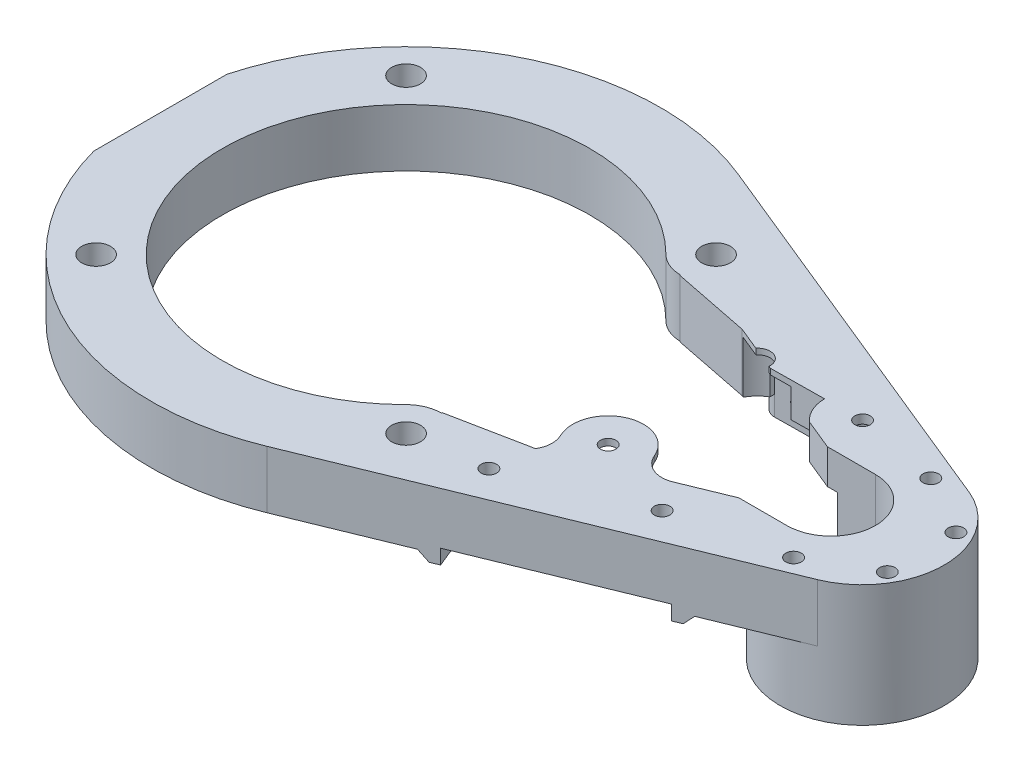
from build123d import *
from build123d.topology import SkipClean

# Parameters (mm, degrees)
SKETCH1_R               = 3.25
BOSS_EXTRUDE1_DEPTH     = 13
BOSS_EXTRUDE2_START     = -14.5
BOSS_EXTRUDE2_DEPTH     = 14.5
CUT_EXTRUDE1_REACH      = 139.202
SKETCH3_R               = 1.75
CUT_EXTRUDE2_DEPTH      = 1.2
BOSS_EXTRUDE3_START     = -1.3
BOSS_EXTRUDE3_OUTLINE_R = 1.75
BOSS_EXTRUDE3_DEPTH     = 1.3
SKETCH6_R               = 8.5
CUT_EXTRUDE3_DEPTH      = 11.7
BOSS_EXTRUDE4_START     = 0.2
SKETCH7_R               = 4.1
SKETCH7_R_2             = 1.75
BOSS_EXTRUDE4_DEPTH     = 0.2
CUT_EXTRUDE4_DEPTH      = 1.3
CUT_EXTRUDE5_REACH      = 137.343
SKETCH9_R               = 1.75
BOSS_EXTRUDE5_DEPTH     = 2
CUT_EXTRUDE6_REACH      = 151.713
CUT_EXTRUDE7_DEPTH      = 5.2
SKETCH16_R              = 2.675
CUT_EXTRUDE9_DEPTH      = 5.8
CUT_EXTRUDE10_REACH     = 138.815
SKETCH17_R              = 1.75
BOSS_EXTRUDE6_START     = 0.2
SKETCH18_R              = 3.175
SKETCH18_R_2            = 2.675
BOSS_EXTRUDE6_DEPTH     = 0.2
CUT_EXTRUDE11_REACH     = 137.854
SKETCH20_R              = 8
CUT_EXTRUDE12_DEPTH     = 6.5
CUT_EXTRUDE13_REACH     = 138.948
SKETCH21_R              = 2.85
BOSS_EXTRUDE7_START     = 4.5
BOSS_EXTRUDE7_DEPTH     = 4.5
FILLET1_R               = 3
CUT_EXTRUDE14_REACH     = 150.769
SKETCH23_R              = 1.875
CUT_EXTRUDE15_START     = -5.2
CUT_EXTRUDE15_DEPTH     = 5.2
CUT_EXTRUDE16_DEPTH     = 2.5
SKETCH26_R              = 2.85
CUT_EXTRUDE17_DEPTH     = 8
FILLET2_R               = 5.5


# Read off the part's stored shape, not the designer's step: Boss-Extrude3
with BuildPart() as part:
    # Sketch1 → Boss-Extrude1 (new body)
    with BuildSketch(Plane(origin=(0, 0, 0), x_dir=(1, 0, 0), z_dir=(0, 1, 0))):
        with BuildLine():
            ThreePointArc((21.76947877, 53.217002819), (-25.477840581, 51.544536415), (-55.5, 15.023634545))
            Line((-55.5, 15.023634545), (-55.5, -15.023634545))
            ThreePointArc((-55.5, -15.023634545), (-25.477840581, -51.544536415), (21.76947877, -53.217002819))
            Line((21.76947877, -53.217002819), (110.004400793, -17.122744217))
            ThreePointArc((110.004400793, -17.122744217), (121.5, 0), (110.004400793, 17.122744217))
            Line((110.004400793, 17.122744217), (21.76947877, 53.217002819))
        make_face()
        with Locations(Location((-35, -35, 0), (0, 0, 90))):
            Circle(SKETCH1_R, mode=Mode.SUBTRACT)
        with Locations(Location((35, -35, 0), (0, 0, 90))):
            Circle(SKETCH1_R, mode=Mode.SUBTRACT)
        with Locations(Location((-35, 35, 0), (0, 0, 90))):
            Circle(SKETCH1_R, mode=Mode.SUBTRACT)
        with BuildLine():
            Line((35, -26.842197909), (35, -27))
            ThreePointArc((35, -27), (31.938532454, -27.608963776), (29.343145617, -29.343145884))
            ThreePointArc((29.343145617, -29.343145884), (-41.497474683, 1.5e-07), (29.343145829, 29.343145672))
            ThreePointArc((29.343145829, 29.343145672), (31.938532593, 27.608963719), (35, 27))
            Line((35, 27), (35, 26.842197909))
            Line((35, 26.842197909), (52.547252782, 23.339790487))
            Line((52.547252782, 23.339790487), (85.157297123, 10))
            Line((85.157297123, 10), (96, 10))
            ThreePointArc((96, 10), (106, 0), (96, -10))
            Line((96, -10), (85.157297123, -10))
            Line((85.157297123, -10), (52.547252782, -23.339790487))
            Line((52.547252782, -23.339790487), (35, -26.842197909))
        make_face(mode=Mode.SUBTRACT)
        with Locations(Location((35, 35, 0), (0, 0, 90))):
            Circle(SKETCH1_R, mode=Mode.SUBTRACT)
    extrude(amount=BOSS_EXTRUDE1_DEPTH)

    # Sketch2 → Boss-Extrude2 (add)
    with BuildSketch(Plane(origin=(0, 0, 0), x_dir=(1, 0, 0), z_dir=(0, 1, 0)).offset(BOSS_EXTRUDE2_START)):
        with BuildLine():
            ThreePointArc((96, 10), (106, 0), (96, -10))
            Line((96, -10), (87.435617584, -10))
            ThreePointArc((87.435617584, -10), (108.210994401, -17.750930605), (121.5, 0))
            ThreePointArc((121.5, 0), (108.210994401, 17.750930605), (87.435617584, 10))
            Line((87.435617584, 10), (96, 10))
        make_face()
    extrude(amount=BOSS_EXTRUDE2_DEPTH)

    # Sketch3 → Cut-Extrude1 (cut, up to next)
    with BuildSketch(Plane.XZ.offset(14.5), mode=Mode.PRIVATE) as cut_extrude1_sk1:
        with Locations(Location((103, 15.5, 0), (0, 0, 270))):
            Circle(SKETCH3_R)
    cut_extrude1_tool1 = extrude(cut_extrude1_sk1.sketch, amount=-CUT_EXTRUDE1_REACH, mode=Mode.PRIVATE) & part.part
    # Sketch3 → Cut-Extrude1 (cut, up to next)
    with BuildSketch(Plane.XZ.offset(14.5), mode=Mode.PRIVATE) as cut_extrude1_sk2:
        with Locations(Location((116.423393759, 7.75, 0), (0, 0, 270))):
            Circle(SKETCH3_R)
    cut_extrude1_tool2 = extrude(cut_extrude1_sk2.sketch, amount=-CUT_EXTRUDE1_REACH, mode=Mode.PRIVATE) & part.part
    # Sketch3 → Cut-Extrude1 (cut, up to next)
    with BuildSketch(Plane.XZ.offset(14.5), mode=Mode.PRIVATE) as cut_extrude1_sk3:
        with Locations(Location((116.423393759, -7.75, 0), (0, 0, 270))):
            Circle(SKETCH3_R)
    cut_extrude1_tool3 = extrude(cut_extrude1_sk3.sketch, amount=-CUT_EXTRUDE1_REACH, mode=Mode.PRIVATE) & part.part
    # Sketch3 → Cut-Extrude1 (cut, up to next)
    with BuildSketch(Plane.XZ.offset(14.5), mode=Mode.PRIVATE) as cut_extrude1_sk4:
        with Locations(Location((103, -15.5, 0), (0, 0, 270))):
            Circle(SKETCH3_R)
    cut_extrude1_tool4 = extrude(cut_extrude1_sk4.sketch, amount=-CUT_EXTRUDE1_REACH, mode=Mode.PRIVATE) & part.part
    add(cut_extrude1_tool1.solids().sort_by_distance((103, -14.5, 15.5))[0], mode=Mode.SUBTRACT)
    add(cut_extrude1_tool2.solids().sort_by_distance((116.423394, -14.5, 7.75))[0], mode=Mode.SUBTRACT)
    add(cut_extrude1_tool3.solids().sort_by_distance((116.423394, -14.5, -7.75))[0], mode=Mode.SUBTRACT)
    add(cut_extrude1_tool4.solids().sort_by_distance((103, -14.5, -15.5))[0], mode=Mode.SUBTRACT)

    # Sketch4 → Cut-Extrude2 (cut)
    with BuildSketch(Plane.XZ):
        with BuildLine():
            Line((-33.430992924, 29.144385874), (-29.144385874, 33.430992924))
            Line((-29.144385874, 33.430992924), (-30.609318431, 38.898195655))
            ThreePointArc((-30.609318431, 38.898195655), (-31.629620263, 38.073181139), (-32.627695318, 37.221411825))
            ThreePointArc((-32.627695318, 37.221411825), (-31.977377776, 36.194259139), (-31.75, 35))
            ThreePointArc((-31.75, 35), (-33.707152064, 32.018214593), (-37.221411825, 32.627695318))
            ThreePointArc((-37.221411825, 32.627695318), (-38.073181139, 31.629620263), (-38.898195655, 30.609318431))
            Line((-38.898195655, 30.609318431), (-33.430992924, 29.144385874))
        make_face()
        with BuildLine():
            ThreePointArc((-32.627695318, 37.221411825), (-31.629620263, 38.073181139), (-30.609318431, 38.898195655))
            Line((-30.609318431, 38.898195655), (-30.71339295, 39.28660705))
            Line((-30.71339295, 39.28660705), (-36.569007076, 40.855614126))
            Line((-36.569007076, 40.855614126), (-40.855614126, 36.569007076))
            Line((-40.855614126, 36.569007076), (-39.28660705, 30.71339295))
            Line((-39.28660705, 30.71339295), (-38.898195655, 30.609318431))
            ThreePointArc((-38.898195655, 30.609318431), (-38.073181139, 31.629620263), (-37.221411825, 32.627695318))
            ThreePointArc((-37.221411825, 32.627695318), (-37.298097039, 37.298097039), (-32.627695318, 37.221411825))
        make_face()
        with BuildLine():
            ThreePointArc((32.627695318, 37.221411825), (31.629620263, 38.073181139), (30.609318431, 38.898195655))
            Line((30.609318431, 38.898195655), (29.144385874, 33.430992924))
            Line((29.144385874, 33.430992924), (33.430992924, 29.144385874))
            Line((33.430992924, 29.144385874), (38.898195655, 30.609318431))
            ThreePointArc((38.898195655, 30.609318431), (38.073181139, 31.629620263), (37.221411825, 32.627695318))
            ThreePointArc((37.221411825, 32.627695318), (32.701902961, 32.701902961), (32.627695318, 37.221411825))
        make_face()
        with BuildLine():
            Line((30.71339295, 39.28660705), (30.609318431, 38.898195655))
            ThreePointArc((30.609318431, 38.898195655), (31.629620263, 38.073181139), (32.627695318, 37.221411825))
            ThreePointArc((32.627695318, 37.221411825), (36.194259139, 38.022622224), (38.25, 35))
            ThreePointArc((38.25, 35), (37.981785407, 33.707152064), (37.221411825, 32.627695318))
            ThreePointArc((37.221411825, 32.627695318), (38.073181139, 31.629620263), (38.898195655, 30.609318431))
            Line((38.898195655, 30.609318431), (39.28660705, 30.71339295))
            Line((39.28660705, 30.71339295), (40.855614126, 36.569007076))
            Line((40.855614126, 36.569007076), (36.569007076, 40.855614126))
            Line((36.569007076, 40.855614126), (30.71339295, 39.28660705))
        make_face()
        with BuildLine():
            ThreePointArc((37.221411825, -32.627695318), (38.073181139, -31.629620263), (38.898195655, -30.609318431))
            Line((38.898195655, -30.609318431), (33.430992924, -29.144385874))
            Line((33.430992924, -29.144385874), (29.144385874, -33.430992924))
            Line((29.144385874, -33.430992924), (30.609318431, -38.898195655))
            ThreePointArc((30.609318431, -38.898195655), (31.629620263, -38.073181139), (32.627695318, -37.221411825))
            ThreePointArc((32.627695318, -37.221411825), (32.701902961, -32.701902961), (37.221411825, -32.627695318))
        make_face()
        with BuildLine():
            Line((39.28660705, -30.71339295), (38.898195655, -30.609318431))
            ThreePointArc((38.898195655, -30.609318431), (38.073181139, -31.629620263), (37.221411825, -32.627695318))
            ThreePointArc((37.221411825, -32.627695318), (37.981785407, -33.707152064), (38.25, -35))
            ThreePointArc((38.25, -35), (36.194259139, -38.022622224), (32.627695318, -37.221411825))
            ThreePointArc((32.627695318, -37.221411825), (31.629620263, -38.073181139), (30.609318431, -38.898195655))
            Line((30.609318431, -38.898195655), (30.71339295, -39.28660705))
            Line((30.71339295, -39.28660705), (36.569007076, -40.855614126))
            Line((36.569007076, -40.855614126), (40.855614126, -36.569007076))
            Line((40.855614126, -36.569007076), (39.28660705, -30.71339295))
        make_face()
        with BuildLine():
            ThreePointArc((-37.221411825, -32.627695318), (-38.073181139, -31.629620263), (-38.898195655, -30.609318431))
            Line((-38.898195655, -30.609318431), (-39.28660705, -30.71339295))
            Line((-39.28660705, -30.71339295), (-40.855614126, -36.569007076))
            Line((-40.855614126, -36.569007076), (-36.569007076, -40.855614126))
            Line((-36.569007076, -40.855614126), (-30.71339295, -39.28660705))
            Line((-30.71339295, -39.28660705), (-30.609318431, -38.898195655))
            ThreePointArc((-30.609318431, -38.898195655), (-31.629620263, -38.073181139), (-32.627695318, -37.221411825))
            ThreePointArc((-32.627695318, -37.221411825), (-37.298097039, -37.298097039), (-37.221411825, -32.627695318))
        make_face()
        with BuildLine():
            Line((-33.430992924, -29.144385874), (-38.898195655, -30.609318431))
            ThreePointArc((-38.898195655, -30.609318431), (-38.073181139, -31.629620263), (-37.221411825, -32.627695318))
            ThreePointArc((-37.221411825, -32.627695318), (-33.707152064, -32.018214593), (-31.75, -35))
            ThreePointArc((-31.75, -35), (-31.977377776, -36.194259139), (-32.627695318, -37.221411825))
            ThreePointArc((-32.627695318, -37.221411825), (-31.629620263, -38.073181139), (-30.609318431, -38.898195655))
            Line((-30.609318431, -38.898195655), (-29.144385874, -33.430992924))
            Line((-29.144385874, -33.430992924), (-33.430992924, -29.144385874))
        make_face()
    extrude(amount=-CUT_EXTRUDE2_DEPTH, mode=Mode.SUBTRACT)

    # Boss-Extrude3 outline → Boss-Extrude3 (add)
    with BuildSketch(Plane(origin=(0, 13, 0), x_dir=(1, 0, 0), z_dir=(0, 1, 0)).offset(BOSS_EXTRUDE3_START)):
        with BuildLine():
            ThreePointArc((67.404429932, -11.336069928), (56.971069928, -6.960570068), (52.595570068, -17.393930072))
            Line((52.595570068, -17.393930072), (54.672249825, -22.47051797))
            Line((54.672249825, -22.47051797), (69.481109688, -16.412657825))
            Line((69.481109688, -16.412657825), (67.404429932, -11.336069928))
        make_face()
        with Locations((60, -14.365)):
            Circle(BOSS_EXTRUDE3_OUTLINE_R, mode=Mode.SUBTRACT)
    extrude(amount=BOSS_EXTRUDE3_DEPTH)

    # Sketch6 → Cut-Extrude3 (cut)
    with BuildSketch(Plane.XZ):
        with Locations((60, 14.365)):
            Circle(SKETCH6_R)
    extrude(amount=-CUT_EXTRUDE3_DEPTH, mode=Mode.SUBTRACT)

    # Sketch7 → Boss-Extrude4 (add)
    with SkipClean():  # the faces are left unmerged after this step: merging them gives an invalid solid
        with BuildSketch(Plane.XZ.offset(-11.7).offset(BOSS_EXTRUDE4_START)):
            with Locations(Location((60, 14.365, 0), (0, 0, 90))):
                Circle(SKETCH7_R)
            with Locations(Location((60, 14.365, 0), (0, 0, 90))):
                Circle(SKETCH7_R_2, mode=Mode.SUBTRACT)
        extrude(amount=-BOSS_EXTRUDE4_DEPTH)

    # Sketch8 → Cut-Extrude4 (cut)
    with SkipClean():  # the faces are left unmerged after this step: merging them gives an invalid solid
        with BuildSketch(Plane.XZ):
            with BuildLine():
                Line((63.218238202, 22.232206803), (68.134539901, 34.250447761))
                Line((68.134539901, 34.250447761), (49.623465072, 41.822772942))
                Line((49.623465072, 41.822772942), (42.854077508, 25.274534885))
                Line((42.854077508, 25.274534885), (52.547252782, 23.339790487))
                Line((52.547252782, 23.339790487), (56.066588393, 21.900135907))
                ThreePointArc((56.066588393, 21.900135907), (59.60574625, 22.855851782), (63.218238202, 22.232206803))
            make_face()
            with BuildLine():
                Line((68.08677112, 16.983039888), (80.587754586, 11.869262716))
                Line((80.587754586, 11.869262716), (86.645614731, 26.67812258))
                Line((86.645614731, 26.67812258), (68.134539901, 34.250447761))
                Line((68.134539901, 34.250447761), (63.218238202, 22.232206803))
                ThreePointArc((63.218238202, 22.232206803), (66.232114189, 20.14520352), (68.08677112, 16.983039888))
            make_face()
        extrude(amount=-CUT_EXTRUDE4_DEPTH, mode=Mode.SUBTRACT)

    # Sketch9 → Cut-Extrude5 (cut, up to next)
    with BuildSketch(Plane.XZ.offset(-1.3), mode=Mode.PRIVATE) as cut_extrude5_sk1:
        with Locations(Location((51.222303707, 32.525261715, 0), (0, 0, 270))):
            Circle(SKETCH9_R)
    cut_extrude5_tool1 = extrude(cut_extrude5_sk1.sketch, amount=-CUT_EXTRUDE5_REACH, mode=Mode.PRIVATE) & part.part
    # Sketch9 → Cut-Extrude5 (cut, up to next)
    with BuildSketch(Plane.XZ.offset(-1.3), mode=Mode.PRIVATE) as cut_extrude5_sk2:
        with Locations(Location((78.988915951, 21.166773943, 0), (0, 0, 270))):
            Circle(SKETCH9_R)
    cut_extrude5_tool2 = extrude(cut_extrude5_sk2.sketch, amount=-CUT_EXTRUDE5_REACH, mode=Mode.PRIVATE) & part.part
    add(cut_extrude5_tool1.solids().sort_by_distance((51.222304, 1.3, 32.525262))[0], mode=Mode.SUBTRACT)
    add(cut_extrude5_tool2.solids().sort_by_distance((78.988916, 1.3, 21.166774))[0], mode=Mode.SUBTRACT)

    # Sketch10 → Boss-Extrude5 (add)
    with SkipClean():  # the faces are left unmerged after this step: merging them gives an invalid solid
        with BuildSketch(Plane.XZ):
            Polygon((49.623465072, 41.822772942), (45.921250106, 43.337237979), (38.858572547, 26.072032158), (42.854077508, 25.274534885), align=None)
            Polygon((80.587754586, 11.869262716), (84.289969552, 10.35479768), (90.347829697, 25.163657544), (86.645614731, 26.67812258), align=None)
        extrude(amount=BOSS_EXTRUDE5_DEPTH)

    # Sketch12 → Cut-Extrude6 (cut, up to next)
    with BuildSketch(Plane(origin=(21.76947877, 0, 53.217002819), x_dir=(0.9255537414846885, 0, -0.3786162590588188), z_dir=(0.3786162590588188, 0, 0.9255537414846885)), mode=Mode.PRIVATE) as cut_extrude6_sk1:
        Polygon((28.094401928, -2), (26.094401928, 0), (26.094401928, -2), align=None)
    cut_extrude6_tool1 = extrude(cut_extrude6_sk1.sketch, amount=-CUT_EXTRUDE6_REACH, mode=Mode.PRIVATE) & part.part
    # Sketch12 → Cut-Extrude6 (cut, up to next)
    with BuildSketch(Plane(origin=(21.76947877, 0, 53.217002819), x_dir=(0.9255537414846885, 0, -0.3786162590588188), z_dir=(0.3786162590588188, 0, 0.9255537414846885)), mode=Mode.PRIVATE) as cut_extrude6_sk2:
        Polygon((74.094401928, -2), (74.094401928, 0), (72.094401928, -2), align=None)
    cut_extrude6_tool2 = extrude(cut_extrude6_sk2.sketch, amount=-CUT_EXTRUDE6_REACH, mode=Mode.PRIVATE) & part.part
    add(cut_extrude6_tool1.solids().sort_by_distance((46.538286, -1.333333, 43.084827))[0], mode=Mode.SUBTRACT)
    add(cut_extrude6_tool2.solids().sort_by_distance((89.730794, -1.333333, 25.416068))[0], mode=Mode.SUBTRACT)

    # Sketch13 → Cut-Extrude7 (cut)
    with SkipClean():  # the faces are left unmerged after this step: merging them gives an invalid solid
        with BuildSketch(Plane.XZ):
            with BuildLine():
                ThreePointArc((89.949011715, -13.111891731), (88.607959574, -11.624077269), (87.435617584, -10))
                Line((87.435617584, -10), (85.157297123, -10))
                Line((85.157297123, -10), (52.962724747, -23.169833375))
                ThreePointArc((52.962724747, -23.169833375), (55.864729512, -26.213323736), (59.909391264, -27.364486862))
                Line((59.909391264, -27.364486862), (83.85634031, -27.635729608))
                ThreePointArc((83.85634031, -27.635729608), (84.089767593, -27.635168178), (84.323091439, -27.628197158))
                Line((84.323091439, -27.628197158), (89.639992889, -25.453212339))
                ThreePointArc((89.639992889, -25.453212339), (92.449948722, -19.349042726), (89.949011715, -13.111891731))
            make_face()
        extrude(amount=-CUT_EXTRUDE7_DEPTH, mode=Mode.SUBTRACT)

    # Sketch16 → Cut-Extrude9 (cut)
    with SkipClean():  # the faces are left unmerged after this step: merging them gives an invalid solid
        with BuildSketch(Plane.XZ.offset(-5.2)):
            with Locations(Location((83.952612092, -19.136274817, 0), (0, 0, 270))):
                Circle(SKETCH16_R)
        extrude(amount=-CUT_EXTRUDE9_DEPTH, mode=Mode.SUBTRACT)

    # Sketch17 → Cut-Extrude10 (cut, up to next)
    with BuildSketch(Plane.XZ.offset(-11), mode=Mode.PRIVATE) as cut_extrude10_sk1:
        with Locations(Location((83.952612092, -19.136274817, 0), (0, 0, 270))):
            Circle(SKETCH17_R)
    cut_extrude10_tool1 = extrude(cut_extrude10_sk1.sketch, amount=-CUT_EXTRUDE10_REACH, mode=Mode.PRIVATE) & part.part
    add(cut_extrude10_tool1.solids().sort_by_distance((83.952612, 11, -19.136275))[0], mode=Mode.SUBTRACT)

    # Sketch18 → Boss-Extrude6 (add)
    with SkipClean():  # the faces are left unmerged after this step: merging them gives an invalid solid
        with BuildSketch(Plane.XZ.offset(-5.2).offset(BOSS_EXTRUDE6_START)):
            with Locations(Location((83.952612092, -19.136274817, 0), (0, 0, 270))):
                Circle(SKETCH18_R)
            with Locations(Location((83.952612092, -19.136274817, 0), (0, 0, 270))):
                Circle(SKETCH18_R_2, mode=Mode.SUBTRACT)
        extrude(amount=-BOSS_EXTRUDE6_DEPTH)

    # Sketch19 → Cut-Extrude11 (cut, up to next)
    with BuildSketch(Plane.XZ.offset(-5.2), mode=Mode.PRIVATE) as cut_extrude11_sk1:
        with BuildLine():
            Line((63.392336264, -18.903392304), (75.453157301, -19.040003035))
            ThreePointArc((75.453157301, -19.040003035), (76.207242728, -15.634953148), (78.265231294, -12.819337294))
            Line((78.265231294, -12.819337294), (63.392336264, -18.903392304))
        make_face()
    cut_extrude11_tool1 = extrude(cut_extrude11_sk1.sketch, amount=-CUT_EXTRUDE11_REACH, mode=Mode.PRIVATE) & part.part
    add(cut_extrude11_tool1.solids().sort_by_distance((71.966851, 5.2, -17.026793))[0], mode=Mode.SUBTRACT)

    # Sketch20 → Cut-Extrude12 (cut)
    with SkipClean():  # the faces are left unmerged after this step: merging them gives an invalid solid
        with BuildSketch(Plane.XZ.offset(-5.2)):
            with Locations((60, -19.365)):
                Circle(SKETCH20_R)
        extrude(amount=-CUT_EXTRUDE12_DEPTH, mode=Mode.SUBTRACT)

    # Sketch21 → Cut-Extrude13 (cut, up to next)
    with BuildSketch(Plane.XZ.offset(-11.7), mode=Mode.PRIVATE) as cut_extrude13_sk1:
        with Locations((60, -19.365)):
            Circle(SKETCH21_R)
    cut_extrude13_tool1 = extrude(cut_extrude13_sk1.sketch, amount=-CUT_EXTRUDE13_REACH, mode=Mode.PRIVATE) & part.part
    add(cut_extrude13_tool1.solids().sort_by_distance((60, 11.7, -19.365))[0], mode=Mode.SUBTRACT)

    # Sketch22 → Boss-Extrude7 (add)
    with SkipClean():  # the faces are left unmerged after this step: merging them gives an invalid solid
        with BuildSketch(Plane.XZ.offset(BOSS_EXTRUDE7_START)):
            with BuildLine():
                Line((59.909391264, -27.364486862), (52.916109884, -27.285275233))
                Line((52.916109884, -27.285275233), (52.766007133, -40.537253295))
                Line((52.766007133, -40.537253295), (84.323091439, -27.628197158))
                ThreePointArc((84.323091439, -27.628197158), (84.089767593, -27.635168178), (83.85634031, -27.635729608))
                Line((83.85634031, -27.635729608), (59.909391264, -27.364486862))
            make_face()
        extrude(amount=-BOSS_EXTRUDE7_DEPTH)

    # Fillet1
    # the kernel refuses this fillet: 3 mm, written as the material it takes off along each edge
    with BuildSketch(Plane(origin=(52.766007133, -15.809153559, -40.537253295), x_dir=(0.9255537414846886, 0, 0.37861625905881824), z_dir=(0, 1, 0))) as fillet1_piece_1:
        with BuildLine():
            CenterArc((FILLET1_R * 1.50788714121, -FILLET1_R), FILLET1_R, 90, 112.896948011)
            Line((FILLET1_R * 0.586681009384, -FILLET1_R * 1.38907488057), (0, 0))
            Line((0, 0), (FILLET1_R * 1.50788714121, 0))
        make_face()
    extrude(amount=15.809153559, mode=Mode.SUBTRACT)
    with BuildSketch(Plane(origin=(84.323091439, 0, -27.628197158), x_dir=(-0.9255537414846893, 0, -0.3786162590588165), z_dir=(0, 1, 0))) as fillet1_piece_2:
        with BuildLine():
            CenterArc((14.846594104, 3), FILLET1_R, 112.896948011, 157.103051989)
            Line((13.679369463, 5.763618395), (13.562646998, 6.039980235))
            ThreePointArc((13.562646998, 6.039980235), (0.318132697, 0.446109719), (-0.101374635, 0.282352941))
            Line((-0.101374635, 0.282352941), (0, -0.3))
            Line((0, -0.3), (14.846594104, -0.3))
            Line((14.846594104, -0.3), (14.846594104, 0))
        make_face()
    extrude(amount=5.2, mode=Mode.SUBTRACT)
    with BuildSketch(Plane(origin=(89.639992889, -18.709690663, -25.453212339), x_dir=(0.9255537414846882, 0, 0.3786162590588192), z_dir=(0, 1, 0))) as fillet1_piece_3:
        with BuildLine():
            CenterArc((7.483876265, -3), FILLET1_R, 90, 115.771461741)
            ThreePointArc((4.782269938, -4.304347826), (2.81414142, -1.682200036), (0, 0))
            Line((0, 0), (7.483876265, 0))
        make_face()
    extrude(amount=23.909690663, mode=Mode.SUBTRACT)
    with BuildSketch(Plane(origin=(52.916109884, -12, -27.285275233), x_dir=(-0.011326091980841106, 0, -0.9999358577631074), z_dir=(0, 1, 0))) as fillet1_piece_4:
        with BuildLine():
            CenterArc((FILLET1_R, -FILLET1_R), FILLET1_R, 90, 90)
            Line((0, -FILLET1_R), (0, 0))
            Line((0, 0), (FILLET1_R, 0))
        make_face()
    extrude(amount=12, mode=Mode.SUBTRACT)
    with BuildSketch(Plane(origin=(84.323091439, -41.616485261, -27.628197158), x_dir=(-0.9255537414846883, 0, -0.378616259058819), z_dir=(0, 1, 0))) as fillet1_piece_5:
        with BuildLine():
            CenterArc((14.846594104, 3), FILLET1_R, 112.896948011, 157.103051989)
            Line((13.679369463, 5.763618395), (13.562646998, 6.039980235))
            ThreePointArc((13.562646998, 6.039980235), (0.318132697, 0.446109719), (-0.101374635, 0.282352941))
            Line((-0.101374635, 0.282352941), (0, -0.3))
            Line((0, -0.3), (14.846594104, -0.3))
            Line((14.846594104, -0.3), (14.846594104, 0))
        make_face()
    extrude(amount=41.616485261, mode=Mode.SUBTRACT)

    # Cut-Extrude14: up to this plane
    cut_extrude14_end = Plane(origin=(21.76947877, 13, -53.217002819), z_dir=(-0.37861625905881874, 0, 0.9255537414846885))
    # Sketch23 → Cut-Extrude14 (cut, up to the surface)
    with BuildSketch(Plane(origin=(-0.302227617, 0, -26.682480783), x_dir=(0.9999358577631076, 0, -0.011326091980841476), z_dir=(0.011326091980841476, 0, 0.9999358577631076)), mode=Mode.PRIVATE) as cut_extrude14_sk1:
        with Locations((63.004177683, 0.25)):
            Circle(SKETCH23_R)
    cut_extrude14_tool1 = split(extrude(cut_extrude14_sk1.sketch, amount=-CUT_EXTRUDE14_REACH, mode=Mode.PRIVATE), bisect_by=cut_extrude14_end, keep=Keep.BOTH, mode=Mode.PRIVATE)
    add(cut_extrude14_tool1.solids().sort_by_distance((62.697909, 0.25, -27.396072))[0], mode=Mode.SUBTRACT)

    # Sketch24 → Cut-Extrude15 (cut)
    with BuildSketch(Plane.XZ.offset(CUT_EXTRUDE15_START)):
        with BuildLine():
            Line((55.915917457, -26.243973018), (55.915917457, -27.319253509))
            Line((55.915917457, -27.319253509), (59.909391264, -27.364486862))
            ThreePointArc((59.909391264, -27.364486862), (57.83877358, -27.067538566), (55.915917457, -26.243973018))
        make_face()
    extrude(amount=CUT_EXTRUDE15_DEPTH, mode=Mode.SUBTRACT)

    # Sketch25 → Cut-Extrude16 (cut)
    with BuildSketch(Plane(origin=(-0.302227617, 0, -26.682480783), x_dir=(0.9999358577631076, 0, -0.011326091980841476), z_dir=(0.011326091980841476, 0, 0.9999358577631076))):
        Polygon((61.358729415, -2.6), (64.64962595, -2.6), (66.295074217, 0.25), (64.64962595, 3.1), (61.358729415, 3.1), (59.713281148, 0.25), align=None)
    extrude(amount=-CUT_EXTRUDE16_DEPTH, mode=Mode.SUBTRACT)

    # Sketch26 → Cut-Extrude17 (cut)
    with BuildSketch(Plane(origin=(-0.472118997, 0, -41.681518649), x_dir=(0.9999358577631076, 0, -0.011326091980841476), z_dir=(0.011326091980841476, 0, 0.9999358577631076))):
        with Locations(Location((63.004177683, 0.25, 0), (0, 0, 180))):
            Circle(SKETCH26_R)
    extrude(amount=CUT_EXTRUDE17_DEPTH, mode=Mode.SUBTRACT)

    # Fillet2
    # the kernel refuses this fillet: 5.5 mm, written as the material it adds along each edge
    with BuildSketch(Plane(origin=(69.481109688, 11.7, 16.412657825), x_dir=(-0.37861709989767967, 0, -0.9255533975222989), z_dir=(0, 1, 0))) as fillet2_piece_1:
        with BuildLine():
            CenterArc((5.499995003, -5.499996574), FILLET2_R, 90.063950984, 89.935996964)
            Line((-4.997e-06, -5.499991577), (-0.550004997, -5.499991078))
            Line((-0.550004997, -5.499991078), (-0.55, 5e-07))
            Line((-0.55, 5e-07), (5e-07, 0.55))
            ThreePointArc((5e-07, 0.55), (5.484920142, 0.549995017), (5.493242266, 0.549999657))
            Line((5.493242266, 0.549999657), (5.493856151, 0))
        make_face()
    extrude(amount=1.3)
    with BuildSketch(Plane(origin=(54.672249825, 11.7, 22.47051797), x_dir=(-0.9255537415250505, 0, 0.37861625896015105), z_dir=(0, 1, 0))) as fillet2_piece_2:
        with BuildLine():
            CenterArc((5.500000001, -4.470332118), FILLET2_R, 125.630805786, 54.369194222)
            Line((1e-09, -4.470332119), (-0.109999999, -4.470332119))
            Line((-0.109999999, -4.470332119), (-0.11, 0))
            Line((-0.11, 0), (0, 0.11))
            ThreePointArc((0, 0.11), (1.147959836, 0.11), (2.231838066, 0.089406642))
            Line((2.231838066, 0.089406642), (2.295919672, 0))
        make_face()
    extrude(amount=1.3)


solid = part.part
